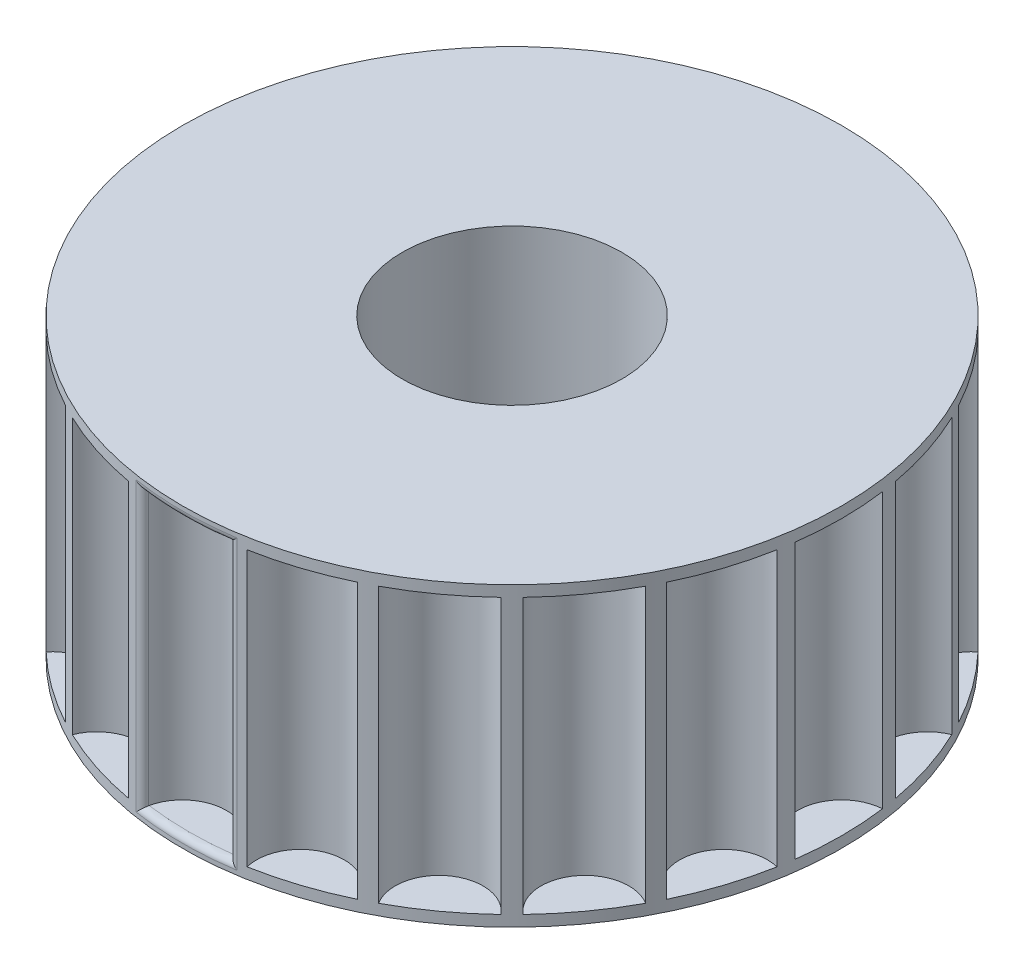
from build123d import *

# Parameters (mm, degrees)
SKETCH_2_R               = 15
EXTRUDE_1_DEPTH          = 13
SKETCH_8_R               = 2
CUT_EXTRUDE_10_DEPTH     = 12.5
EXTRUDE_START            = 0.5
SKETCH_10_R              = 15
EXTRUDE_4_DEPTH          = 0.5
SKETCH_11_R              = 12
EXTRUDE_5_DEPTH          = 0.5
SKETCH_12_R              = 5
CUT_EXTRUDE_12_DEPTH     = 26.416530054
FILLET_START             = -0.3000001
FILLET_2_DEPTH           = 13.1000002
FILLET_2_2_ANGLE         = 17.614798
PATTERN_CIRCULAR_1_COUNT = 20


with BuildPart() as part:
    # 草图2 → 凸台-拉伸1 (new body)
    with BuildSketch(Plane(origin=(0, 0, 0), x_dir=(1, 0, 0), z_dir=(0, 1, 0))):
        with Locations(Location((0, 0, 0), (0, 0, 90))):
            Circle(SKETCH_2_R)
    extrude(amount=EXTRUDE_1_DEPTH)

    # 草图8 → 切除-拉伸10 (cut)
    with BuildSketch(Plane.XZ):
        with Locations((0, 15)):
            Circle(SKETCH_8_R)
    cut_extrude_10 = extrude(amount=-CUT_EXTRUDE_10_DEPTH, mode=Mode.SUBTRACT)

    # 草图10 → 凸台-拉伸4 (add)
    with BuildSketch(Plane.XZ.offset(EXTRUDE_START)):
        with Locations(Location((0, 0, 0), (0, 0, 270))):
            Circle(SKETCH_10_R)
    extrude(amount=-EXTRUDE_4_DEPTH)

    # 草图11 → 凸台-拉伸5 (add)
    with BuildSketch(Plane.XZ.offset(0.5)):
        with Locations(Location((0, 0, 0), (0, 0, 270))):
            Circle(SKETCH_11_R)
    extrude(amount=EXTRUDE_5_DEPTH)

    # 草图12 → 切除-拉伸12 (cut, through all)
    with BuildSketch(Plane.XZ.offset(1)):
        with Locations(Location((0, 0, 0), (0, 0, 270))):
            Circle(SKETCH_12_R)
    extrude(amount=-CUT_EXTRUDE_12_DEPTH, mode=Mode.SUBTRACT)

    # 圆角2: read off the stored shape, not the designer's step
    # 圆角2 outline → 圆角2 (cut)
    with BuildSketch(Plane(origin=(0, 0, 0), x_dir=(1, 0, 0), z_dir=(0, 1, 0)).offset(FILLET_START)):
        with BuildLine():
            ThreePointArc((2.296701806, -14.823129252), (2.080163818, -14.773434354), (1.957189365, -14.588405797))
            ThreePointArc((1.957189365, -14.588405797), (0, -13), (-1.957189365, -14.588405797))
            ThreePointArc((-1.957189365, -14.588405797), (-2.080163818, -14.773434354), (-2.296701806, -14.823129252))
            ThreePointArc((-2.296701806, -14.823129252), (0, -15), (2.296701806, -14.823129252))
        make_face()
    extrude(amount=FILLET_2_DEPTH, mode=Mode.SUBTRACT)

    # Fillet 2 2 outline → Fillet 2 2 (revolve)
    with BuildSketch(Plane(origin=(0, 0, 0), x_dir=(-0.1531134537578896, 0, 0.9882086167800453), z_dir=(-0.9882086167800453, 0, -0.1531134537578896))):
        with BuildLine():
            Line((13, 12.8000001), (13, 12.5))
            Line((13, 12.5), (14.7, 12.5))
            ThreePointArc((14.7, 12.5), (14.912132034, 12.587867966), (15, 12.8))
            Line((15, 12.8), (13, 12.8000001))
        make_face()
        with BuildLine():
            Line((14.7, 0), (13, 0))
            Line((13, 0), (13, -0.3000001))
            Line((13, -0.3000001), (15, -0.3))
            ThreePointArc((15, -0.3), (14.912132034, -0.087867966), (14.7, 0))
        make_face()
    revolve(axis=Axis((0, 0, 0), (0, 1, 0)), revolution_arc=FILLET_2_2_ANGLE)

    # 阵列(圆周)1: 切除-拉伸10 ×20 about axis
    pattern_circular_1_axis = Axis((0, 0, 0), (0, 1, 0))
    for i in range(1, PATTERN_CIRCULAR_1_COUNT):
        add(cut_extrude_10.rotate(pattern_circular_1_axis, i * 360 / PATTERN_CIRCULAR_1_COUNT), mode=Mode.SUBTRACT)


solid = part.part
